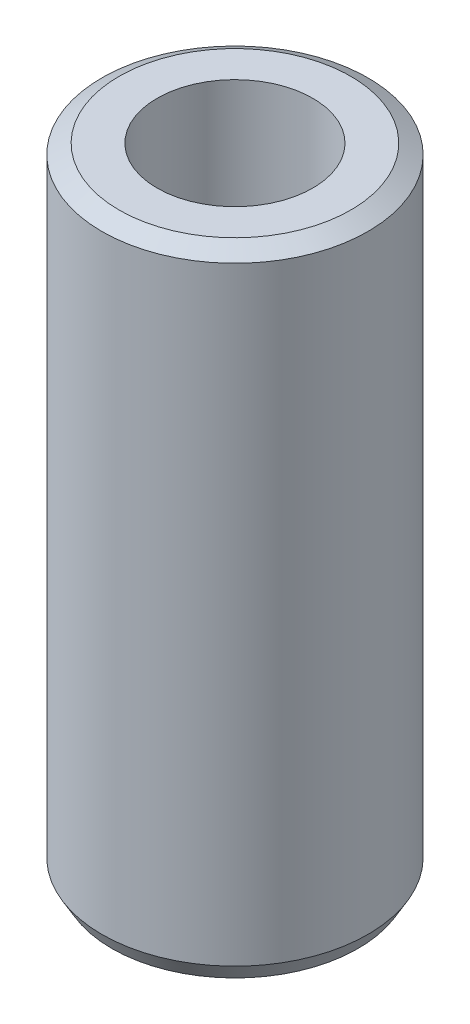
from build123d import *
from OCP.BRepFilletAPI import BRepFilletAPI_MakeChamfer

# Parameters (mm, degrees)
SKETCH1_R           = 20
BOSS_EXTRUDE1_DEPTH = 95.570602537
SKETCH2_R           = 11.700116409
CUT_EXTRUDE1_DEPTH  = 100.668149724
CHAMFER1_SIZE       = 1.494239157
CHAMFER1_SIZE2      = 2.588098138


with BuildPart() as part:
    # Sketch1 → Boss-Extrude1 (new body)
    with BuildSketch(Plane(origin=(0, 0, 0), x_dir=(1, 0, 0), z_dir=(0, 1, 0))):
        Circle(SKETCH1_R)
    extrude(amount=BOSS_EXTRUDE1_DEPTH)

    # Sketch2 → Cut-Extrude1 (cut, through all)
    with BuildSketch(Plane(origin=(0, 0, 0), x_dir=(1, 0, 0), z_dir=(0, 1, 0))):
        Circle(SKETCH2_R)
    extrude(amount=CUT_EXTRUDE1_DEPTH, mode=Mode.SUBTRACT)

    # Chamfer1: one chamfer whose edges measure the first distance from different faces: ONE call of the kernel's chamfer builder (chamfer() names one face for all edges)
    chamfer1_edges_1 = [part.edges().sort_by_distance(p)[0] for p in [
        (-20, 95.570602537, 0),
    ]]
    chamfer1_side_1 = [part.faces().sort_by_distance(p)[0] for p in [
        (-20, 47.785301269, 0),
    ]]
    chamfer1_edges_2 = [part.edges().sort_by_distance(p)[0] for p in [
        (-20, 0, 0),
    ]]
    chamfer1_side_2 = [part.faces().sort_by_distance(p)[0] for p in [
        (-19.434314575, 0, 0),
    ]]
    chamfer1 = BRepFilletAPI_MakeChamfer(part.part.solid().wrapped)
    for e in chamfer1_edges_1:
        chamfer1.Add(CHAMFER1_SIZE, CHAMFER1_SIZE2, e.wrapped, chamfer1_side_1[0].wrapped)  # the first distance lies on this face
    for e in chamfer1_edges_2:
        chamfer1.Add(CHAMFER1_SIZE, CHAMFER1_SIZE2, e.wrapped, chamfer1_side_2[0].wrapped)  # the first distance lies on this face
    add(Compound.cast(chamfer1.Shape()), mode=Mode.REPLACE)


solid = part.part
